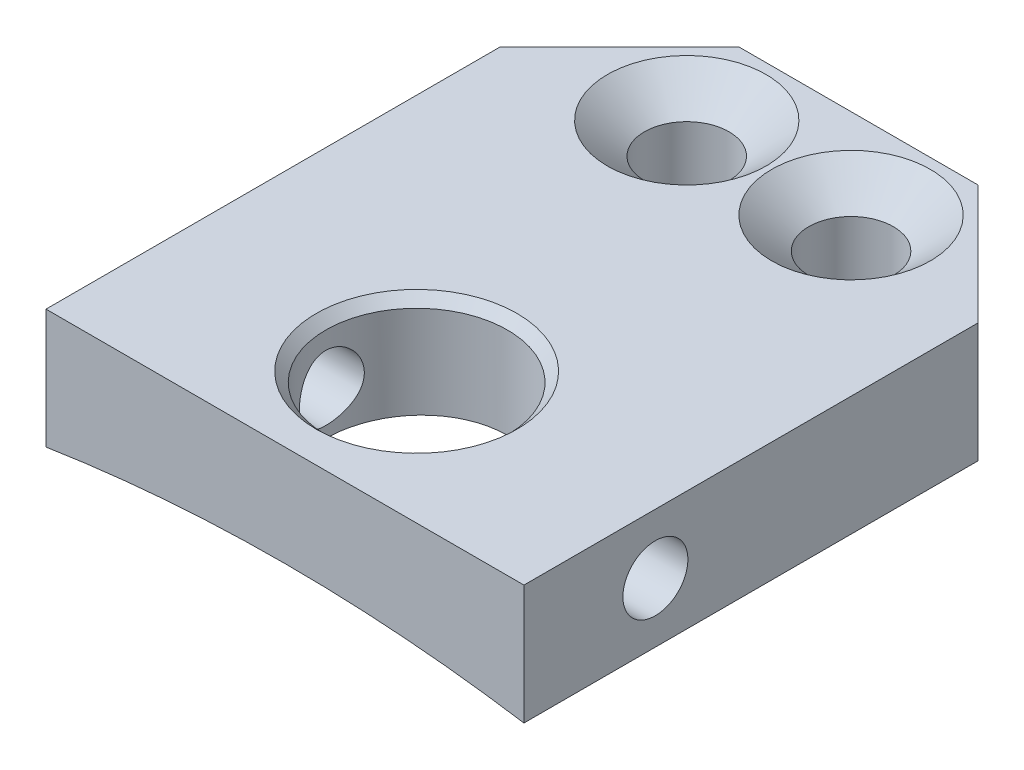
from build123d import *

# Parameters (mm, degrees)
BOSS_EXTRUDE1_DEPTH                               = 6.35
CSK_FOR_8_FLAT_HEAD_MACHINE_SCREW_100_D           = 4.4958
CSK_FOR_8_FLAT_HEAD_MACHINE_SCREW_100_CSINK_D     = 8.4328
CSK_FOR_8_FLAT_HEAD_MACHINE_SCREW_100_CSINK_ANGLE = 100
SKETCH2_R                                         = 82.042
CUT_EXTRUDE1_DEPTH                                = 43.217023873
SKETCH5_R                                         = 1.1303
CUT_EXTRUDE2_DEPTH                                = 35.271884391
SKETCH6_R                                         = 4.826
CUT_EXTRUDE3_DEPTH                                = 35.271884391
CHAMFER1_SIZE                                     = 0.508
F_8_32_TAPPED_HOLE1_D                             = 3.4544


with BuildPart() as part:
    # Sketch1 → Boss-Extrude1 (new body)
    with BuildSketch(Plane(origin=(0, 0, 0), x_dir=(1, 0, 0), z_dir=(0, 1, 0))):
        Polygon((-28.511825699, 11.575271113), (-22.161825699, 17.925271113), (-9.461825699, 17.925271113), (-3.111825699, 11.575271113), (-3.111825699, -12.554728887), (-28.511825699, -12.554728887), align=None)
    extrude(amount=BOSS_EXTRUDE1_DEPTH)

    # CSK for #8 Flat Head Machine Screw (100)1 (through all)
    with Locations(Plane(origin=(0, 6.35, 0), x_dir=(1, 0, 0), z_dir=(0, 1, 0))):
        with Locations((-20.177450699, 13.162771113), (-11.446200699, 13.162771113)):
            CounterSinkHole(CSK_FOR_8_FLAT_HEAD_MACHINE_SCREW_100_D / 2, CSK_FOR_8_FLAT_HEAD_MACHINE_SCREW_100_CSINK_D / 2, counter_sink_angle=CSK_FOR_8_FLAT_HEAD_MACHINE_SCREW_100_CSINK_ANGLE)

    # Sketch2 → Cut-Extrude1 (cut, through all)
    with BuildSketch(Plane.XY.offset(12.554728887)):
        with Locations((-15.811825699, -81.053067579)):
            Circle(SKETCH2_R)
    extrude(amount=-CUT_EXTRUDE1_DEPTH, mode=Mode.SUBTRACT)

    # Sketch5 → Cut-Extrude2 (cut, through all)
    with BuildSketch(Plane(origin=(0, 6.35, 0), x_dir=(1, 0, 0), z_dir=(0, 1, 0))):
        with Locations((-15.799380503, -5.569728887)):
            Circle(SKETCH5_R)
    extrude(amount=-CUT_EXTRUDE2_DEPTH, mode=Mode.SUBTRACT)

    # Sketch6 → Cut-Extrude3 (cut, through all)
    with BuildSketch(Plane(origin=(0, 6.35, 0), x_dir=(1, 0, 0), z_dir=(0, 1, 0))):
        with Locations((-15.799380503, -5.569728887)):
            Circle(SKETCH6_R)
    extrude(amount=-CUT_EXTRUDE3_DEPTH, mode=Mode.SUBTRACT)

    # Chamfer1
    chamfer1_edges = [part.edges().sort_by_distance(p)[0] for p in [
        (-20.625380503, 6.35, 5.569728887),
    ]]
    chamfer(chamfer1_edges, length=CHAMFER1_SIZE)

    # #8-32 Tapped Hole1 (through all)
    with Locations(Plane.ZY.offset(28.511825699)):
        with Locations((5.569728887, 3.175)):
            Hole(F_8_32_TAPPED_HOLE1_D / 2)


solid = part.part
